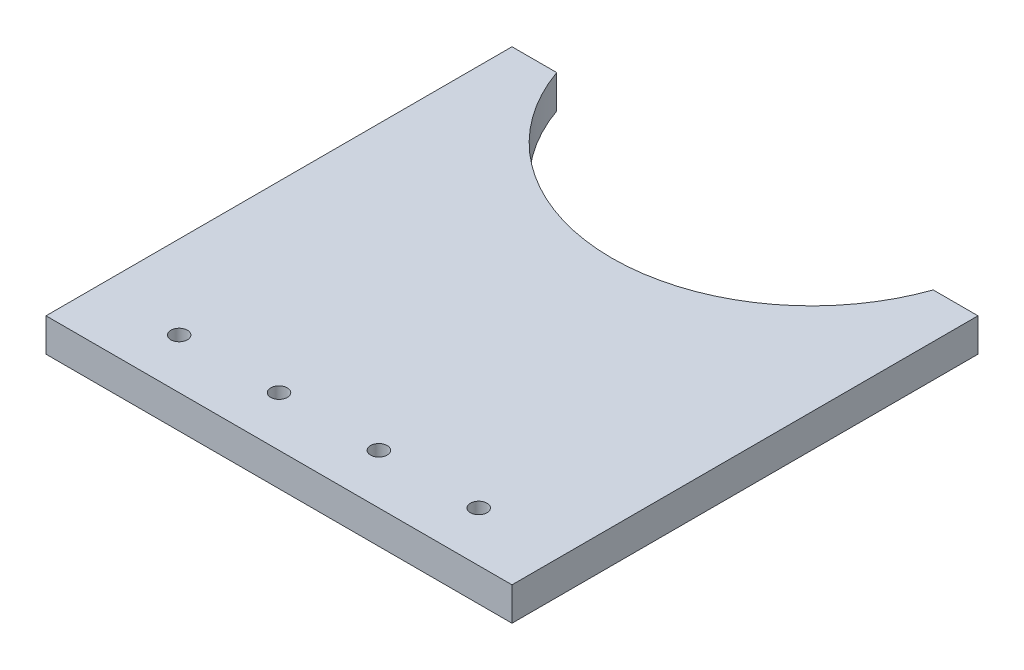
from build123d import *

# Parameters (mm, degrees)
BOSS_EXTRUDE1_DEPTH = 12.7
SKETCH2_R           = 3.175
CUT_EXTRUDE1_DEPTH  = 223.159267194


with BuildPart() as part:
    # Sketch1 → Boss-Extrude1 (new body)
    with BuildSketch(Plane(origin=(0, 0, 0), x_dir=(1, 0, 0), z_dir=(0, 1, 0))):
        with BuildLine():
            Line((-88.9, -25.4), (-71.842048969, -25.4))
            ThreePointArc((-71.842048969, -25.4), (0, -76.2), (71.842048969, -25.4))
            Line((71.842048969, -25.4), (88.9, -25.4))
            Line((88.9, -25.4), (88.9, -203.2))
            Line((88.9, -203.2), (-88.9, -203.2))
            Line((-88.9, -203.2), (-88.9, -25.4))
        make_face()
    extrude(amount=BOSS_EXTRUDE1_DEPTH)

    # Sketch2 → Cut-Extrude1 (cut, through all)
    with BuildSketch(Plane(origin=(0, 12.7, 0), x_dir=(1, 0, 0), z_dir=(0, 1, 0))):
        with Locations((-19.05, -184.15)):
            Circle(SKETCH2_R)
        with Locations((19.05, -184.15)):
            Circle(SKETCH2_R)
        with Locations((57.15, -184.15)):
            Circle(SKETCH2_R)
        with Locations((-57.15, -184.15)):
            Circle(SKETCH2_R)
    extrude(amount=-CUT_EXTRUDE1_DEPTH, mode=Mode.SUBTRACT)


solid = part.part
